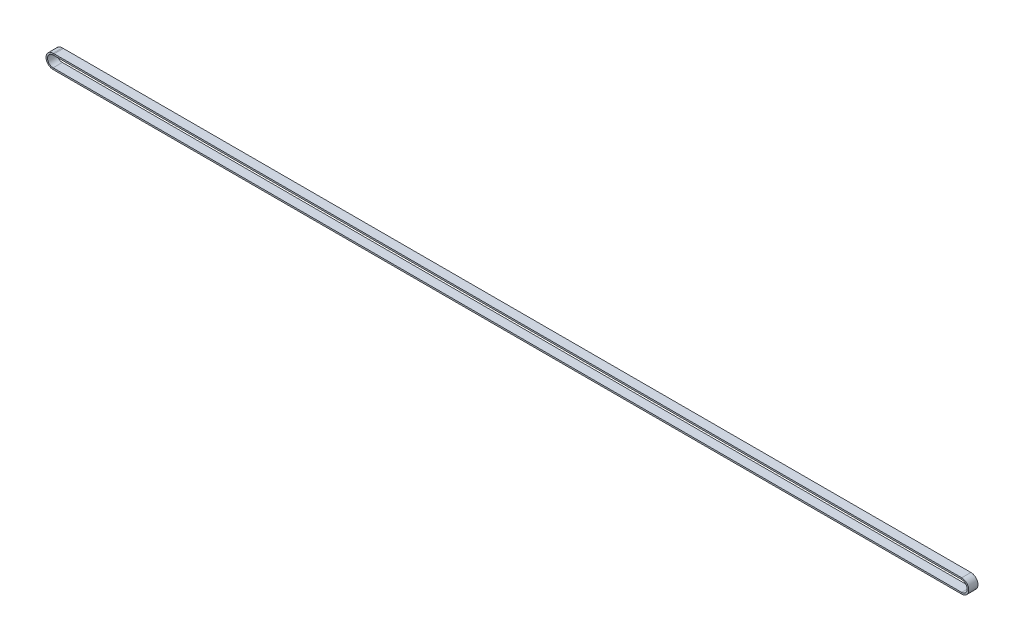
from build123d import *

# Parameters (mm, degrees)
SKETCH3_W = 9
SKETCH3_H = 1.5


with BuildPart() as part:
    # Sweep1: sweep along a path in Sketch2
    with BuildLine(Plane.XY.offset(-121.983366658)) as sweep1_path:
        Line((-1, 148.373424592), (883.520637828, 148.373424592))
        ThreePointArc((883.520637828, 148.373424592), (890.420637828, 141.473424592), (883.520637828, 134.573424592))
        Line((883.520637828, 134.573424592), (-1, 134.573424592))
        ThreePointArc((-1, 134.573424592), (-7.9, 141.473424592), (-1, 148.373424592))
    # Sketch3 → Sweep1 (sweep)
    with BuildSketch(Plane(origin=(0, 0, 0), x_dir=(0, 0, -1), z_dir=(1, 0, 0))):
        with Locations((117.483366658, 147.623424592)):
            Rectangle(SKETCH3_W, SKETCH3_H)
    sweep(path=sweep1_path.line)


solid = part.part
